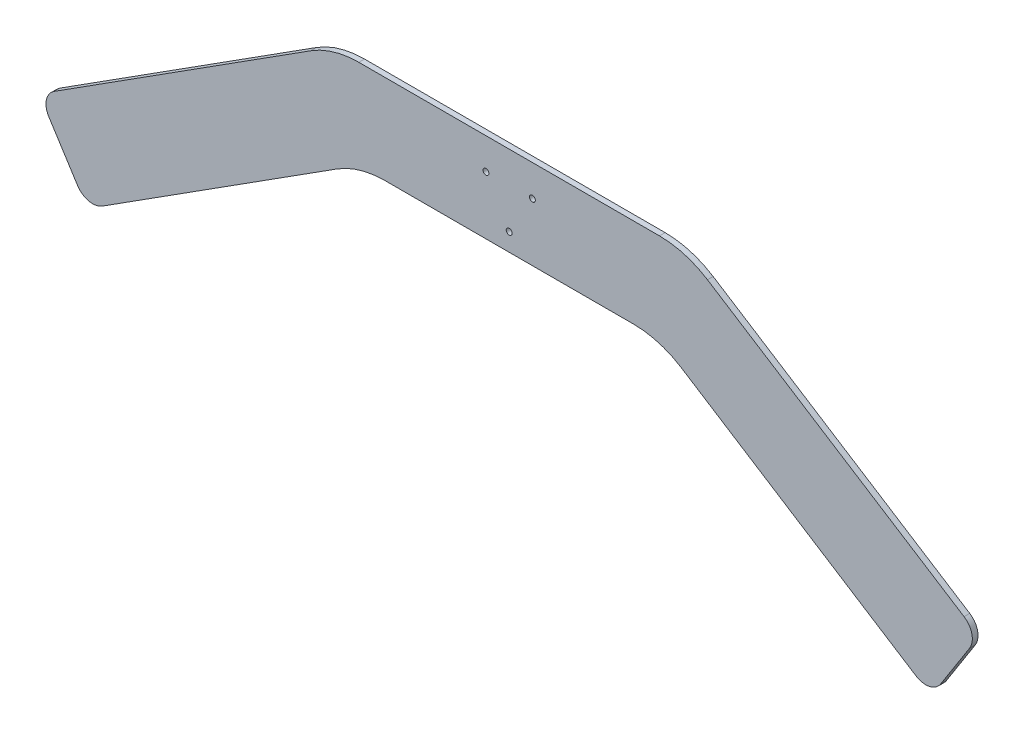
from build123d import *

# Parameters (mm, degrees)
BASE_DEPTH               = 3.175
FILLET1_R                = 10
SKETCH2_R                = 1.65
ADAPTER_ATTACHMENT_DEPTH = 314.410210492


with BuildPart() as part:
    # Sketch1 → Base (new body)
    with BuildSketch(Plane.XY):
        with BuildLine():
            Line((84.089590341, -33.213203436), (-84.089590341, -33.213203436))
            ThreePointArc((-84.089590341, -33.213203436), (-98.081041043, -35.210710716), (-110.954570758, -41.043631145))
            Line((-110.954570758, -41.043631145), (-262.951190812, -137.876157524))
            Line((-262.951190812, -137.876157524), (-236.086210395, -180.045729815))
            Line((-236.086210395, -180.045729815), (-96.380899779, -91.043631145))
            ThreePointArc((-96.380899779, -91.043631145), (-83.507370063, -85.210710716), (-69.515919362, -83.213203436))
            Line((-69.515919362, -83.213203436), (69.515919362, -83.213203436))
            ThreePointArc((69.515919362, -83.213203436), (83.507370063, -85.210710716), (96.380899779, -91.043631145))
            Line((96.380899779, -91.043631145), (236.086210395, -180.045729815))
            Line((236.086210395, -180.045729815), (262.951190812, -137.876157524))
            Line((262.951190812, -137.876157524), (110.954570758, -41.043631145))
            ThreePointArc((110.954570758, -41.043631145), (98.081041043, -35.210710716), (84.089590341, -33.213203436))
        make_face()
    extrude(amount=BASE_DEPTH)

    # Fillet1
    fillet1_edges = [part.edges().sort_by_distance(p)[0] for p in [
        (262.951190812, -137.876157524, 1.5875),
        (236.086210395, -180.045729815, 1.5875),
        (-236.086210395, -180.045729815, 1.5875),
        (-262.951190812, -137.876157524, 1.5875),
    ]]
    fillet(fillet1_edges, radius=FILLET1_R)

    # Sketch2 → Adapter Attachment (cut, through all)
    with BuildSketch(Plane.XY.offset(3.175)):
        with Locations((-12.990381057, -50.713203436)):
            Circle(SKETCH2_R)
        with Locations((12.990381057, -50.713203436)):
            Circle(SKETCH2_R)
        with Locations((0, -73.213203436)):
            Circle(SKETCH2_R)
    extrude(amount=-ADAPTER_ATTACHMENT_DEPTH, mode=Mode.SUBTRACT)


solid = part.part
